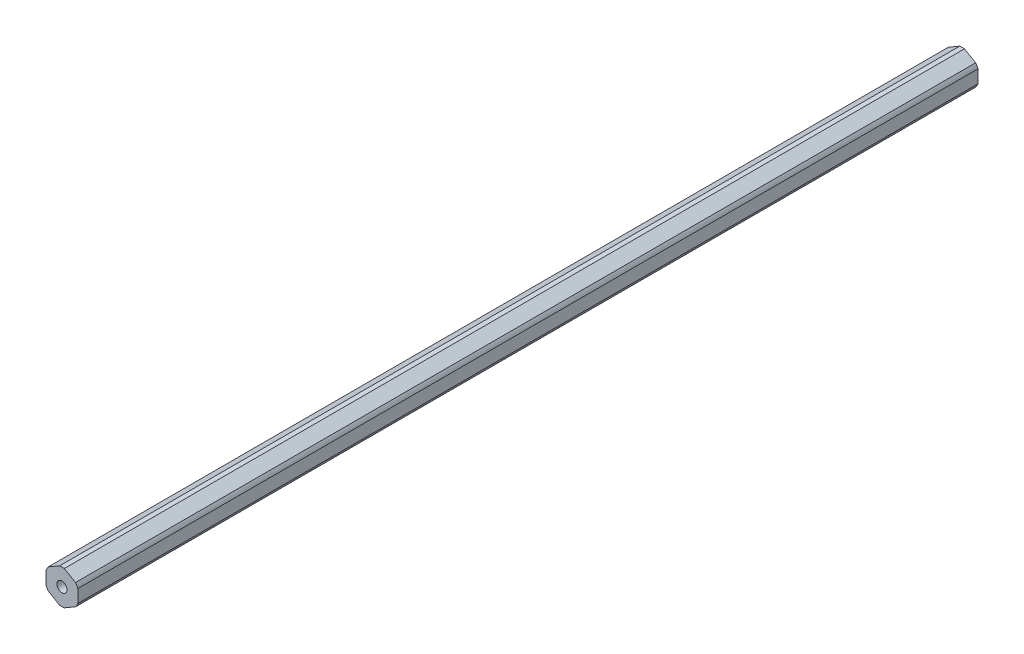
from build123d import *

# Parameters (mm, degrees)
BOSS_EXTRUDE1_DEPTH = 179.5145
SKETCH2_R           = 2.0193
CUT_EXTRUDE1_DEPTH  = 360.150633446


with BuildPart() as part:
    # Sketch1 → Boss-Extrude1 (new, symmetric)
    with BuildSketch(Plane.XY):
        with BuildLine():
            ThreePointArc((6.35, 2.590301913), (5.939202219, 3.429), (5.41826726, 4.204110358))
            Line((5.41826726, 4.204110358), (0.93173274, 6.79441227))
            ThreePointArc((0.93173274, 6.79441227), (0, 6.858), (-0.93173274, 6.79441227))
            Line((-0.93173274, 6.79441227), (-5.41826726, 4.204110358))
            ThreePointArc((-5.41826726, 4.204110358), (-5.939202219, 3.429), (-6.35, 2.590301913))
            Line((-6.35, 2.590301913), (-6.35, -2.590301913))
            ThreePointArc((-6.35, -2.590301913), (-5.939202219, -3.429), (-5.41826726, -4.204110358))
            Line((-5.41826726, -4.204110358), (-0.93173274, -6.79441227))
            ThreePointArc((-0.93173274, -6.79441227), (0, -6.858), (0.93173274, -6.79441227))
            Line((0.93173274, -6.79441227), (5.41826726, -4.204110358))
            ThreePointArc((5.41826726, -4.204110358), (5.939202219, -3.429), (6.35, -2.590301913))
            Line((6.35, -2.590301913), (6.35, 2.590301913))
        make_face()
    extrude(amount=BOSS_EXTRUDE1_DEPTH, both=True)

    # Sketch2 → Cut-Extrude1 (cut, through all)
    with BuildSketch(Plane.XY.offset(179.5145)):
        Circle(SKETCH2_R)
    extrude(amount=-CUT_EXTRUDE1_DEPTH, mode=Mode.SUBTRACT)


solid = part.part
